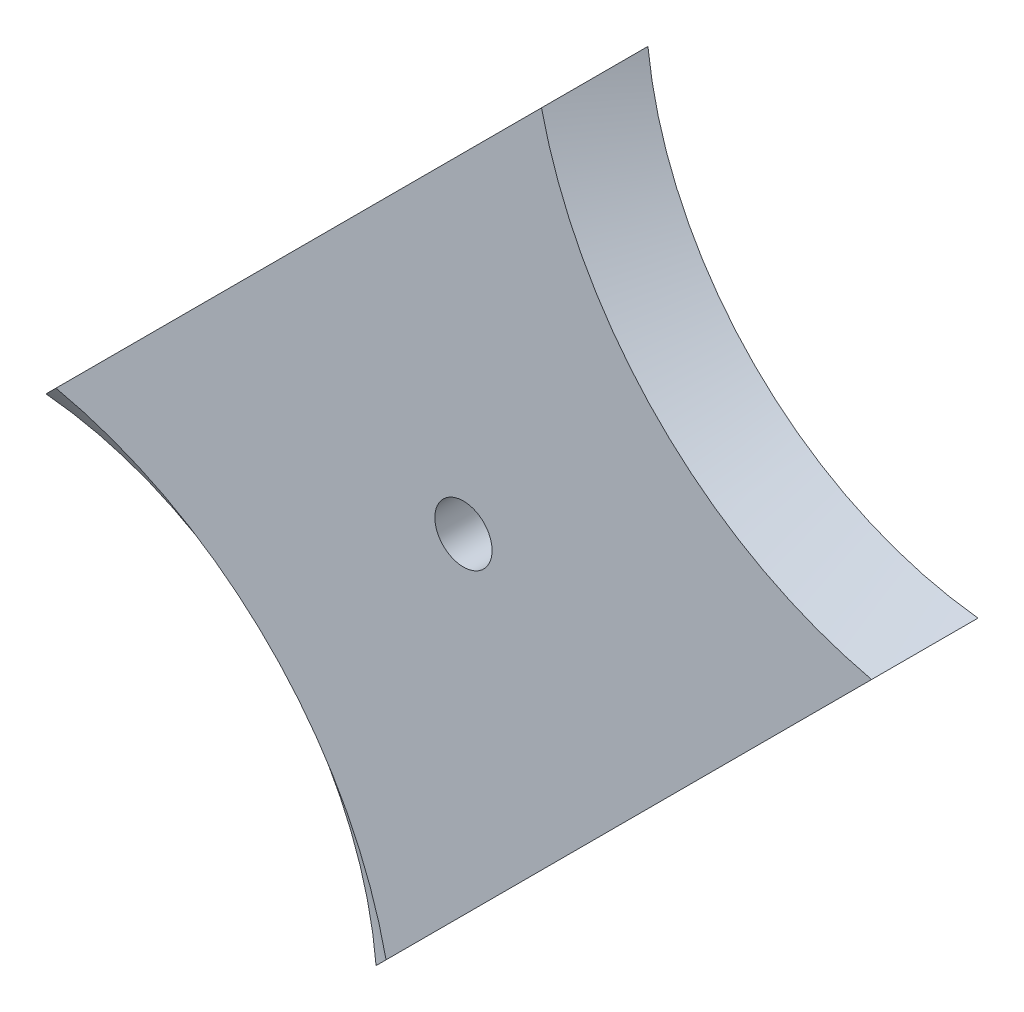
from build123d import *

# Parameters (mm, degrees)
SKETCH3_R           = 2.94685624
BOSS_EXTRUDE1_DEPTH = 5
CHAMFER1_SIZE2      = 6.881909602
CHAMFER1_SIZE       = 5
CHAMFER2_SIZE2      = 5
CHAMFER2_SIZE       = 6.881909602


with BuildPart() as part:
    # Sketch3 → Boss-Extrude1 (new body)
    with BuildSketch(Plane.XY):
        with BuildLine():
            Line((48.567273068, 137.828283654), (110.567273068, 199.828283654))
            ThreePointArc((110.567273068, 199.828283654), (121.583561944, 176.84457253), (144.567273068, 165.828283654))
            Line((144.567273068, 165.828283654), (82.567273068, 103.828283654))
            ThreePointArc((82.567273068, 103.828283654), (71.734296399, 126.995306985), (48.567273068, 137.828283654))
        make_face()
        with Locations((96.567273068, 151.828283654)):
            Circle(SKETCH3_R, mode=Mode.SUBTRACT)
    extrude(amount=BOSS_EXTRUDE1_DEPTH)

    # Chamfer1
    chamfer1_edges = [part.edges().sort_by_distance(p)[0] for p in [
        (121.583561944, 176.84457253, 5),
    ]]
    chamfer1_side = [part.faces().sort_by_distance(p)[0] for p in [
        (121.583561944, 176.84457253, 4.9),
    ]]
    chamfer(chamfer1_edges, length=CHAMFER1_SIZE - 0.0001, length2=CHAMFER1_SIZE2 - 0.0001, reference=chamfer1_side[0])  # a hair under: the kernel refuses the full size

    # Chamfer2
    chamfer2_edges = [part.edges().sort_by_distance(p)[0] for p in [
        (71.734296399, 126.995306985, 5),
    ]]
    chamfer2_side = [part.faces().sort_by_distance(p)[0] for p in [
        (71.805007077, 127.066017663, 5),
    ]]
    chamfer(chamfer2_edges, length=CHAMFER2_SIZE - 0.0001, length2=CHAMFER2_SIZE2 - 0.0001, reference=chamfer2_side[0])  # a hair under: the kernel refuses the full size


solid = part.part
